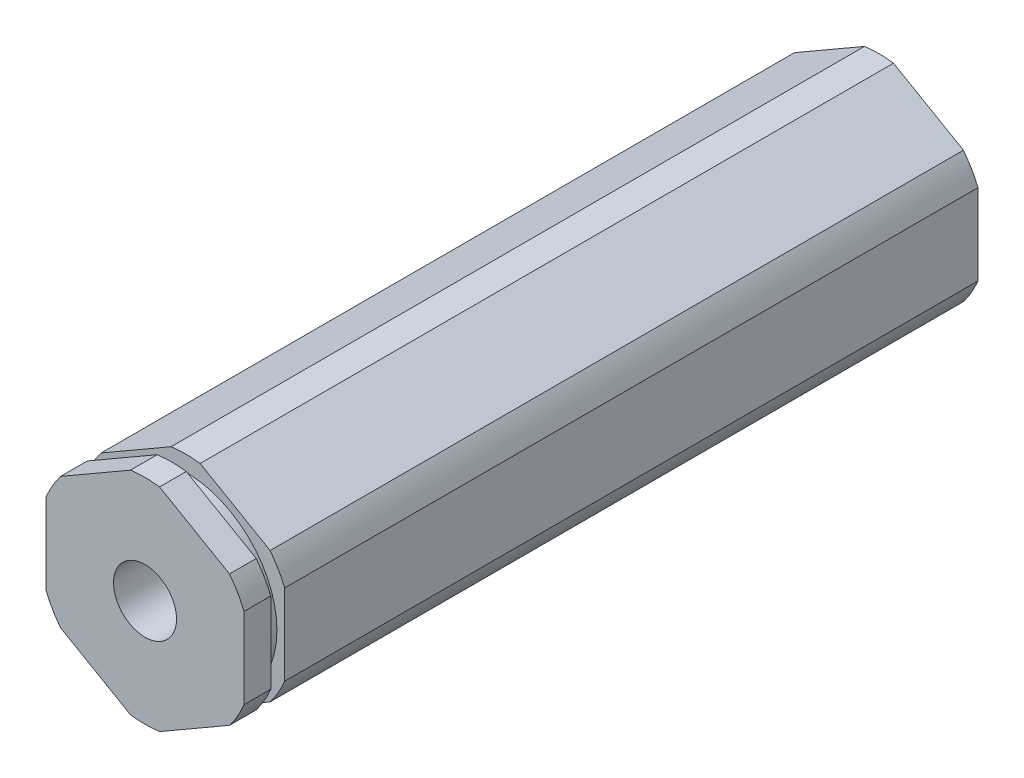
from build123d import *

# Parameters (mm, degrees)
BOSS_EXTRUDE1_DEPTH                  = 23.5331
F_10_32_TAPPED_HOLE1_D               = 4.0386
F_10_32_TAPPED_HOLE1_DEPTH           = 16.34744
F_10_32_TAPPED_HOLE1_TIP             = 1.213317848
F_10_32_TAPPED_HOLE1_ON_FACE_2_D     = 4.0386
F_10_32_TAPPED_HOLE1_ON_FACE_2_DEPTH = 16.34744
F_10_32_TAPPED_HOLE1_ON_FACE_2_TIP   = 1.213317848
SKETCH5_W                            = 0.889
SKETCH5_H                            = 1.0033


with BuildPart() as part:
    # Sketch1 → Boss-Extrude1 (new, symmetric)
    with BuildSketch(Plane.XY):
        with BuildLine():
            ThreePointArc((0.93173274, 6.79441227), (0, 6.858), (-0.93173274, 6.79441227))
            Line((-0.93173274, 6.79441227), (-5.41826726, 4.204110358))
            ThreePointArc((-5.41826726, 4.204110358), (-5.939202219, 3.429), (-6.35, 2.590301913))
            Line((-6.35, 2.590301913), (-6.35, -2.590301913))
            ThreePointArc((-6.35, -2.590301913), (-5.939202219, -3.429), (-5.41826726, -4.204110358))
            Line((-5.41826726, -4.204110358), (-0.93173274, -6.79441227))
            ThreePointArc((-0.93173274, -6.79441227), (0, -6.858), (0.93173274, -6.79441227))
            Line((0.93173274, -6.79441227), (5.41826726, -4.204110358))
            ThreePointArc((5.41826726, -4.204110358), (5.939202219, -3.429), (6.35, -2.590301913))
            Line((6.35, -2.590301913), (6.35, 2.590301913))
            ThreePointArc((6.35, 2.590301913), (5.939202219, 3.429), (5.41826726, 4.204110358))
            Line((5.41826726, 4.204110358), (0.93173274, 6.79441227))
        make_face()
    extrude(amount=BOSS_EXTRUDE1_DEPTH, both=True)

    # #10-32 Tapped Hole1
    with Locations(Plane.XY.offset(23.5331)):
        with Locations((0, 0)):
            Hole(F_10_32_TAPPED_HOLE1_D / 2, depth=F_10_32_TAPPED_HOLE1_DEPTH)
            with Locations((0, 0, -(F_10_32_TAPPED_HOLE1_DEPTH + F_10_32_TAPPED_HOLE1_TIP / 2))):  # 118° drill point
                Cone(0, F_10_32_TAPPED_HOLE1_D / 2, F_10_32_TAPPED_HOLE1_TIP, mode=Mode.SUBTRACT)

    # #10-32 Tapped Hole1 on face 2
    with Locations(Plane(origin=(0, 0, -23.5331), x_dir=(-1, 0, 0), z_dir=(0, 0, -1))):
        with Locations((0, 0)):
            Hole(F_10_32_TAPPED_HOLE1_ON_FACE_2_D / 2, depth=F_10_32_TAPPED_HOLE1_ON_FACE_2_DEPTH)
            with Locations((0, 0, -(F_10_32_TAPPED_HOLE1_ON_FACE_2_DEPTH + F_10_32_TAPPED_HOLE1_ON_FACE_2_TIP / 2))):  # 118° drill point
                Cone(0, F_10_32_TAPPED_HOLE1_ON_FACE_2_D / 2, F_10_32_TAPPED_HOLE1_ON_FACE_2_TIP, mode=Mode.SUBTRACT)

    # Sketch5 → Cut-Revolve1 (revolve, cut)
    with BuildSketch(Plane(origin=(0, 0, 0), x_dir=(0, 0, -1), z_dir=(1, 0, 0))):
        with Locations((-21.3741, 6.35635)):
            Rectangle(SKETCH5_W, SKETCH5_H)
    revolve(axis=Axis((0, 0, 165.047176272), (0, 0, -1)), mode=Mode.SUBTRACT)


solid = part.part
